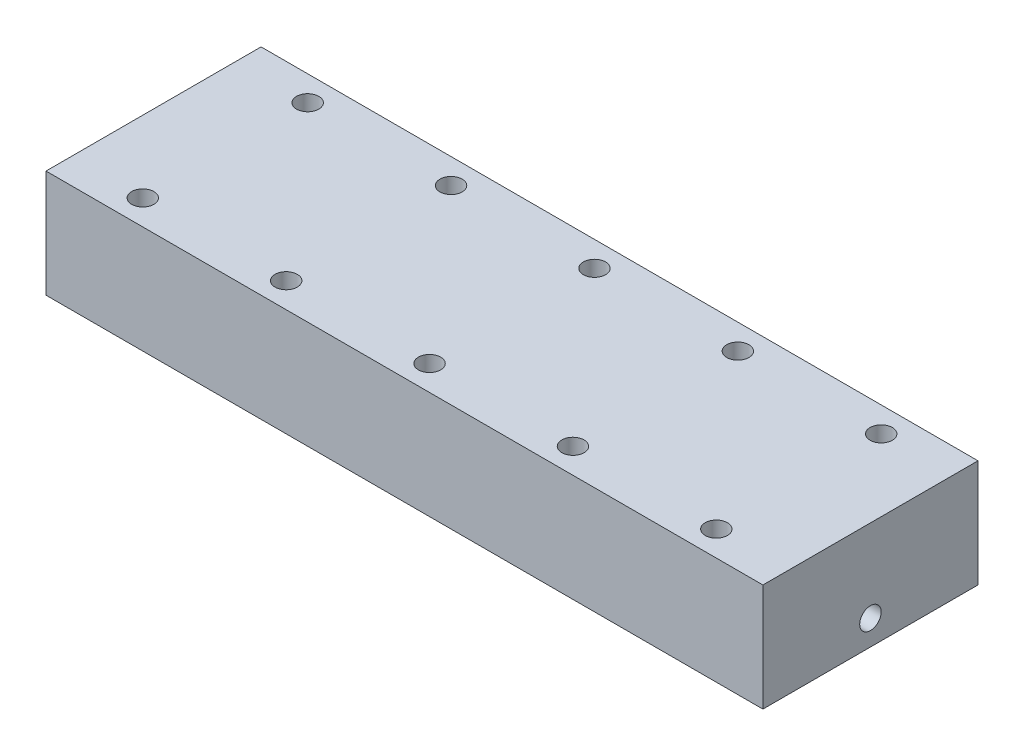
from build123d import *

# Parameters (mm, degrees)
SKETCH1_W               = 100
SKETCH1_H               = 30
BOSS_EXTRUDE1_DEPTH     = 15
CUT_EXTRUDE1_DEPTH      = 8.5
CUT_EXTRUDE1_DEPTH_BACK = 8.5
SKETCH2_W               = 30
SKETCH2_H               = 18
SKETCH4_W               = 10
SKETCH4_H               = 18
BOSS_EXTRUDE2_DEPTH     = 10
REVOLVE1_ANGLE          = 180
REVOLVE2_ANGLE          = 180
REVOLVE3_ANGLE          = 180
SKETCH9_R               = 1
CUT_EXTRUDE2_DEPTH      = 12
SKETCH10_R              = 1.5
CUT_EXTRUDE3_DEPTH      = 12
FILLET3_R               = 1.2
FILLET5_R               = 1.25
FILLET7_R               = 2
CUT_EXTRUDE4_DEPTH      = 20
CUT_EXTRUDE4_DEPTH_BACK = 20
SKETCH11_R              = 1.55


with BuildPart() as part:
    # Sketch1 → Boss-Extrude1 (new body)
    with BuildSketch(Plane(origin=(0, 0, 0), x_dir=(1, 0, 0), z_dir=(0, 1, 0))):
        with Locations((0, 15)):
            Rectangle(SKETCH1_W, SKETCH1_H)
    extrude(amount=BOSS_EXTRUDE1_DEPTH)

    # Sketch2 → Cut-Extrude1 (cut, two sides: drawn at the far end of the back side and taken through both)
    with BuildSketch(Plane(origin=(0, 0, 0), x_dir=(1, 0, 0), z_dir=(0, 1, 0)).offset(-CUT_EXTRUDE1_DEPTH_BACK)):
        with Locations((30, 15)):
            Rectangle(SKETCH2_W, SKETCH2_H)
    extrude(amount=CUT_EXTRUDE1_DEPTH + CUT_EXTRUDE1_DEPTH_BACK, mode=Mode.SUBTRACT)

    # Sketch4 → Boss-Extrude2 (add)
    with BuildSketch(Plane(origin=(0, 0, 0), x_dir=(1, 0, 0), z_dir=(0, 1, 0))):
        with Locations((20, 15)):
            Rectangle(SKETCH4_W, SKETCH4_H)
    extrude(amount=BOSS_EXTRUDE2_DEPTH)

    # Sketch3 → Cut-Revolve1 (revolve, cut)
    with BuildSketch(Plane(origin=(0, 0, 0), x_dir=(1, 0, 0), z_dir=(0, 1, 0))):
        Polygon((-45, 15), (-45, 8.41), (35, 6.89), (35, 15), align=None)
    revolve(axis=Axis((50, 0, -15), (-1, 0, 0)), mode=Mode.SUBTRACT)

    # Sketch6 → Revolve1 (revolve)
    with BuildSketch(Plane(origin=(0, 0, 0), x_dir=(1, 0, 0), z_dir=(0, 1, 0))):
        Polygon((25, 22.92), (25, 20.42), (15.047727794, 20.23), (15, 22.73), align=None)
    revolve(axis=Axis((-50, 0, -15), (1, 0, 0)), revolution_arc=REVOLVE1_ANGLE)

    # Sketch7 → Revolve2 (revolve)
    with BuildSketch(Plane(origin=(0, 0, 0), x_dir=(1, 0, 0), z_dir=(0, 1, 0))):
        Polygon((-35, 21.78), (-22.5, 22.0175), (-22.5, 19.5175), (-35, 19.28), align=None)
    revolve(axis=Axis((-45, 0, -15), (1, 0, 0)), revolution_arc=REVOLVE2_ANGLE)

    # Sketch8 → Revolve3 (revolve)
    with BuildSketch(Plane(origin=(0, 0, 0), x_dir=(1, 0, 0), z_dir=(0, 1, 0))):
        Polygon((-10, 22.255), (-10, 19.755), (2.5, 19.9925), (2.5, 22.4925), align=None)
    revolve(axis=Axis((-45, 0, -15), (1, 0, 0)), revolution_arc=REVOLVE3_ANGLE)

    # Sketch9 → Cut-Extrude2 (cut)
    with BuildSketch(Plane.ZY.offset(50)):
        with Locations((-15, 3.5)):
            Circle(SKETCH9_R)
    extrude(amount=-CUT_EXTRUDE2_DEPTH, mode=Mode.SUBTRACT)

    # Sketch10 → Cut-Extrude3 (cut)
    with BuildSketch(Plane(origin=(50, 0, 0), x_dir=(0, 0, -1), z_dir=(1, 0, 0))):
        with Locations((15, 3.5)):
            Circle(SKETCH10_R)
    extrude(amount=-CUT_EXTRUDE3_DEPTH, mode=Mode.SUBTRACT)

    # Fillet3
    fillet3_edges = [part.edges().sort_by_distance(p)[0] for p in [
        (15.047727794, 5.23, -15),
        (15, 7.73, -15),
        (-10, 7.255, -15),
        (2.5, 7.4925, -15),
        (2.5, 4.9925, -15),
        (-10, 4.755, -15),
        (-22.5, 7.0175, -15),
        (-22.5, 4.5175, -15),
        (-35, 6.78, -15),
        (-35, 4.28, -15),
    ]]
    fillet(fillet3_edges, radius=FILLET3_R)

    # Fillet5
    fillet5_edges = [part.edges().sort_by_distance(p)[0] for p in [
        (25, 5.42, -15),
    ]]
    fillet(fillet5_edges, radius=FILLET5_R)

    # Fillet7
    fillet7_edges = [part.edges().sort_by_distance(p)[0] for p in [
        (25, 4.25, -24),
        (25, 4.25, -6),
        (45, 4.25, -24),
        (35, 8.5, -24),
        (45, 4.25, -6),
        (45, 8.5, -15),
        (35, 8.5, -6),
        (25, 8.5, -15),
    ]]
    fillet(fillet7_edges, radius=FILLET7_R)

    # Sketch11 → Cut-Extrude4 (cut, two sides: drawn at the far end of the back side and taken through both)
    with BuildSketch(Plane(origin=(0, 0, 0), x_dir=(1, 0, 0), z_dir=(0, 1, 0)).offset(-CUT_EXTRUDE4_DEPTH_BACK)):
        with Locations((-40, 3.5)):
            Circle(SKETCH11_R)
        with Locations((-20, 3.5)):
            Circle(SKETCH11_R)
        with Locations((0, 3.5)):
            Circle(SKETCH11_R)
        with Locations((20, 3.5)):
            Circle(SKETCH11_R)
        with Locations((40, 3.5)):
            Circle(SKETCH11_R)
        with Locations((-40, 26.5)):
            Circle(SKETCH11_R)
        with Locations((-20, 26.5)):
            Circle(SKETCH11_R)
        with Locations((0, 26.5)):
            Circle(SKETCH11_R)
        with Locations((20, 26.5)):
            Circle(SKETCH11_R)
        with Locations((40, 26.5)):
            Circle(SKETCH11_R)
    extrude(amount=CUT_EXTRUDE4_DEPTH + CUT_EXTRUDE4_DEPTH_BACK, mode=Mode.SUBTRACT)


solid = part.part
